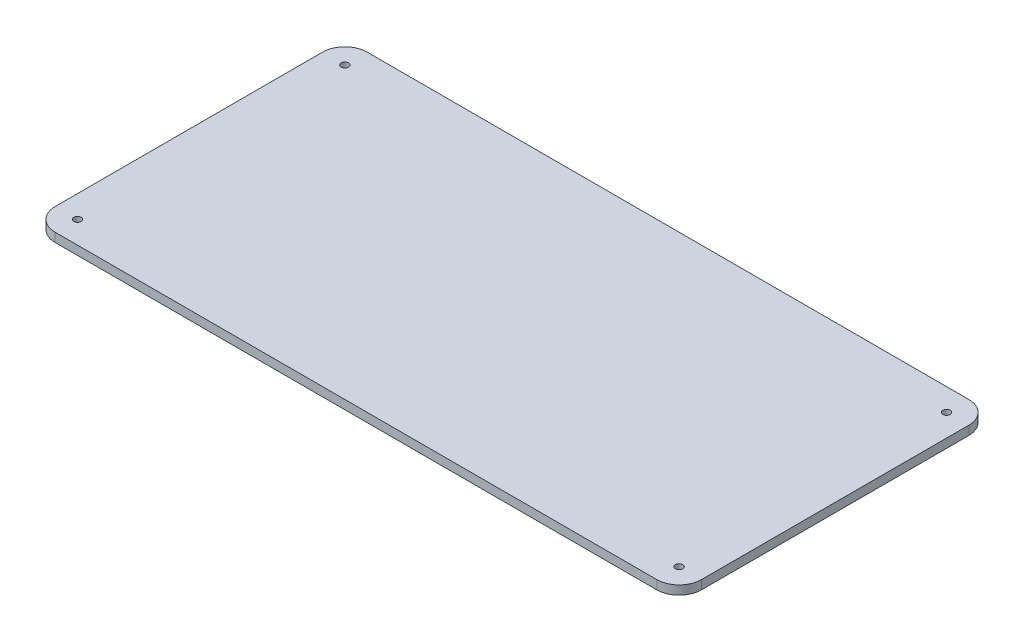
from build123d import *

# Parameters (mm, degrees)
SKETCH1_R               = 1.65
BOSS_EXTRUDE1_DEPTH     = 4
MIRROR2_COPY_1_SKETCH_R = 1.65
MIRROR2_COPY_1_DEPTH    = 4
MIRROR2_COPY_2_SKETCH_R = 1.65
MIRROR2_COPY_2_DEPTH    = 4


with BuildPart() as part:
    # Sketch1 → Boss-Extrude1 (new body)
    with BuildSketch(Plane(origin=(0, 0, 0), x_dir=(1, 0, 0), z_dir=(0, 1, 0))):
        with BuildLine():
            Line((145, -60), (145, 0))
            Line((145, 0), (0, 0))
            Line((0, 0), (0, -70))
            Line((0, -70), (135, -70))
            ThreePointArc((135, -70), (142.071067812, -67.071067812), (145, -60))
        make_face()
        with Locations((135, -60)):
            Circle(SKETCH1_R, mode=Mode.SUBTRACT)
    boss_extrude1 = extrude(amount=BOSS_EXTRUDE1_DEPTH)

    # Mirror1: Boss-Extrude1 across plane
    add(boss_extrude1.mirror(Plane(origin=(0, 0, 0), x_dir=(0, 0, 1), z_dir=(1, 0, 0))))

    # Mirror2 copy 1 sketch → Mirror2 copy 1 (add)
    with BuildSketch(Plane(origin=(0, 0, 0), x_dir=(-1, 0, 0), z_dir=(0, 1, 0))):
        with BuildLine():
            Line((145, -60), (145, 0))
            Line((145, 0), (0, 0))
            Line((0, 0), (0, -70))
            Line((0, -70), (135, -70))
            ThreePointArc((135, -70), (142.071067812, -67.071067812), (145, -60))
        make_face()
        with Locations((135, -60)):
            Circle(MIRROR2_COPY_1_SKETCH_R, mode=Mode.SUBTRACT)
    extrude(amount=MIRROR2_COPY_1_DEPTH)

    # Mirror2 copy 2 sketch → Mirror2 copy 2 (add)
    with BuildSketch(Plane(origin=(0, 0, 0), x_dir=(1, 0, 0), z_dir=(0, 1, 0))):
        with BuildLine():
            Line((145, 60), (145, 0))
            Line((145, 0), (0, 0))
            Line((0, 0), (0, 70))
            Line((0, 70), (135, 70))
            ThreePointArc((135, 70), (142.071067812, 67.071067812), (145, 60))
        make_face()
        with Locations((135, 60)):
            Circle(MIRROR2_COPY_2_SKETCH_R, mode=Mode.SUBTRACT)
    extrude(amount=MIRROR2_COPY_2_DEPTH)


solid = part.part
